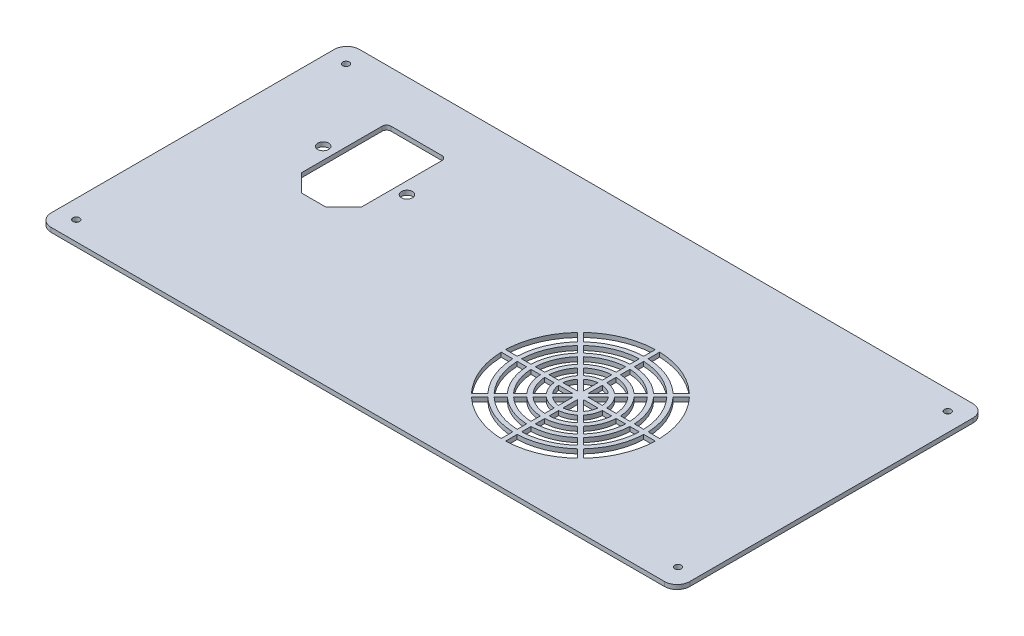
from build123d import *

# Parameters (mm, degrees)
SKETCH1_W          = 290
SKETCH1_H          = 140
BASE_FLANGE1_DEPTH = 2
SKETCH6_R          = 1.5
CUT_EXTRUDE1_DEPTH = 2
FILLET1_R          = 5.7366
SKETCH7_R          = 2.5
CUT_EXTRUDE2_DEPTH = 2
VENT1_START        = -2
VENT1_DEPTH        = 2


# Read off the part's stored shape, not the designer's step: Vent1
# Sheet-metal steps are written as plain solids
with BuildPart() as part:
    # Sketch1 → Base-Flange1 (new body)
    with BuildSketch(Plane(origin=(0, 0, 0), x_dir=(1, 0, 0), z_dir=(0, 1, 0))):
        with Locations((145, -70)):
            Rectangle(SKETCH1_W, SKETCH1_H)
    extrude(amount=-BASE_FLANGE1_DEPTH)

    # Sketch6 → Cut-Extrude1 (cut)
    with BuildSketch(Plane(origin=(0, 0, 0), x_dir=(1, 0, 0), z_dir=(0, 1, 0))):
        with Locations(Location((8.3683, -8.7366, 0), (0, 0, 270))):
            Circle(SKETCH6_R)
        with Locations(Location((281.6317, -8.7366, 0), (0, 0, 270))):
            Circle(SKETCH6_R)
        with Locations(Location((281.6317, -131.2634, 0), (0, 0, 270))):
            Circle(SKETCH6_R)
        with Locations(Location((8.3683, -131.2634, 0), (0, 0, 270))):
            Circle(SKETCH6_R)
    extrude(amount=-CUT_EXTRUDE1_DEPTH, mode=Mode.SUBTRACT)

    # Fillet1
    fillet1_edges = [part.edges().sort_by_distance(p)[0] for p in [
        (0, -1, 0),
        (290, -1, 0),
        (290, -1, 140),
        (0, -1, 140),
    ]]
    fillet(fillet1_edges, radius=FILLET1_R)

    # Sketch7 → Cut-Extrude2 (cut)
    with BuildSketch(Plane.XZ.offset(2)):
        with Locations(Location((73.638744656, 46.342445257, 0), (0, 0, 270))):
            Circle(SKETCH7_R)
        with Locations(Location((35.598744656, 46.342445257, 0), (0, 0, 270))):
            Circle(SKETCH7_R)
        with BuildLine():
            Line((68.173744656, 61.645917903), (68.173744656, 25.015666021))
            ThreePointArc((68.173744656, 25.015666021), (67.587958218, 23.601452459), (66.173744656, 23.015666021))
            Line((66.173744656, 23.015666021), (43.063744656, 23.015666021))
            ThreePointArc((43.063744656, 23.015666021), (41.649531093, 23.601452459), (41.063744656, 25.015666021))
            Line((41.063744656, 25.015666021), (41.063744656, 61.645917903))
            Line((41.063744656, 61.645917903), (49.068744656, 69.635666021))
            Line((49.068744656, 69.635666021), (60.168744656, 69.635666021))
            Line((60.168744656, 69.635666021), (68.173744656, 61.645917903))
        make_face()
    extrude(amount=-CUT_EXTRUDE2_DEPTH, mode=Mode.SUBTRACT)

    # Vent1 outline → Vent1 (cut)
    with BuildSketch(Plane(origin=(0, 0, 0), x_dir=(1, 0, 0), z_dir=(0, 1, 0)).offset(VENT1_START)):
        with BuildLine():
            Line((170.222148937, -65.55259009), (166.508051013, -61.838493933))
            add(Edge.make_bspline(
                [(166.508051013, -61.838493933), (165.164181932, -63.261607055), (162.506821573, -66.595130904), (159.40953845, -72.389740062), (157.502240973, -78.677257217), (157.024121171, -82.913451877), (156.968087147, -84.870003572)],
                knots=[0.37954792, 0.37954792, 0.37954792, 0.37954792, 0.40625, 0.4375, 0.46875, 0.495452077, 0.495452077, 0.495452077, 0.495452077], degree=3))
            Line((156.968087147, -84.870003572), (162.220613562, -84.870004684))
            add(Edge.make_bspline(
                [(170.222148937, -65.55259009), (169.120140685, -66.731444679), (166.900168028, -69.530691555), (164.291172405, -74.411779053), (162.684560899, -79.7080674), (162.274952157, -83.257191332), (162.220613562, -84.870004684)],
                knots=[0.380350766, 0.380350766, 0.380350766, 0.380350766, 0.40625, 0.4375, 0.46875, 0.49464923, 0.49464923, 0.49464923, 0.49464923], degree=3))
        make_face()
        with BuildLine():
            Line((221.686916079, -84.870004937), (226.939442491, -84.87000379))
            add(Edge.make_bspline(
                [(226.939442491, -84.87000379), (226.883408477, -82.913452022), (226.40528868, -78.677257286), (224.497991182, -72.389740062), (221.400708145, -66.595131066), (218.743347928, -63.261607341), (217.399478995, -61.838494332)],
                knots=[0.004547922, 0.004547922, 0.004547922, 0.004547922, 0.03125, 0.0625, 0.09375, 0.120452077, 0.120452077, 0.120452077, 0.120452077], degree=3))
            Line((217.399478995, -61.838494332), (213.685381163, -65.552590591))
            add(Edge.make_bspline(
                [(221.686916079, -84.870004937), (221.632577494, -83.2571915), (221.222968757, -79.708067481), (219.616357227, -74.411779053), (217.007361712, -69.530691758), (214.787389232, -66.731445039), (213.685381163, -65.552590591)],
                knots=[0.005350769, 0.005350769, 0.005350769, 0.005350769, 0.03125, 0.0625, 0.09375, 0.11964923, 0.11964923, 0.11964923, 0.11964923], degree=3))
        make_face()
        with BuildLine():
            Line((171.636358789, -107.601619508), (167.922258745, -111.3157138))
            add(Edge.make_bspline(
                [(167.922258745, -111.3157138), (169.345371868, -112.659582882), (172.678895719, -115.316943242), (178.473504878, -118.414226366), (184.76102204, -120.321523845), (188.997216709, -120.799643646), (190.953768413, -120.855677669)],
                knots=[0.62954792, 0.62954792, 0.62954792, 0.62954792, 0.65625, 0.6875, 0.71875, 0.745452078, 0.745452078, 0.745452078, 0.745452078], degree=3))
            Line((190.953768413, -120.855677669), (190.9537695, -115.603151254))
            add(Edge.make_bspline(
                [(171.636358789, -107.601619508), (172.815212281, -108.70362634), (175.614457941, -110.923597627), (180.495543869, -113.532592411), (185.791832215, -115.139203916), (189.340956148, -115.548812659), (190.9537695, -115.603151254)],
                knots=[0.630350795, 0.630350795, 0.630350795, 0.630350795, 0.65625, 0.6875, 0.71875, 0.74464923, 0.74464923, 0.74464923, 0.74464923], degree=3))
        make_face()
        with BuildLine():
            Line((190.953770185, -56.136848723), (190.953768936, -50.884322316))
            add(Edge.make_bspline(
                [(190.953768936, -50.884322316), (188.997217057, -50.940356314), (184.761022208, -51.418476104), (178.473504878, -53.325773634), (172.678895882, -56.423056671), (169.345372157, -59.080416888), (167.922259147, -60.424285821)],
                knots=[0.25454792, 0.25454792, 0.25454792, 0.25454792, 0.28125, 0.3125, 0.34375, 0.370452077, 0.370452077, 0.370452077, 0.370452077], degree=3))
            Line((167.922259147, -60.424285821), (171.636355407, -64.138383653))
            add(Edge.make_bspline(
                [(190.953770185, -56.136848723), (189.340956603, -56.191187289), (185.791832435, -56.600796017), (180.495543869, -58.207407589), (175.614456574, -60.816403104), (172.815209855, -63.036375584), (171.636355407, -64.138383653)],
                knots=[0.255350766, 0.255350766, 0.255350766, 0.255350766, 0.28125, 0.3125, 0.34375, 0.36964923, 0.36964923, 0.36964923, 0.36964923], degree=3))
        make_face()
        with BuildLine():
            Line((162.220613538, -86.869994631), (156.968087132, -86.86999588))
            add(Edge.make_bspline(
                [(156.968087132, -86.86999588), (157.02412113, -88.826547759), (157.50224092, -93.062742608), (159.40953845, -99.350259938), (162.506821487, -105.144868934), (165.164181703, -108.478392659), (166.508050637, -109.901505668)],
                knots=[0.50454792, 0.50454792, 0.50454792, 0.50454792, 0.53125, 0.5625, 0.59375, 0.620452077, 0.620452077, 0.620452077, 0.620452077], degree=3))
            Line((166.508050637, -109.901505668), (170.22214529, -106.187406009))
            add(Edge.make_bspline(
                [(162.220613538, -86.869994631), (162.274952105, -88.482808213), (162.684560833, -92.031932381), (164.291172405, -97.328220947), (166.900167185, -102.209306867), (169.120138466, -105.008552522), (170.22214529, -106.187406009)],
                knots=[0.505350766, 0.505350766, 0.505350766, 0.505350766, 0.53125, 0.5625, 0.59375, 0.619649205, 0.619649205, 0.619649205, 0.619649205], degree=3))
        make_face()
        with BuildLine():
            Line((192.953759447, -115.603151277), (192.953760721, -120.855677683))
            add(Edge.make_bspline(
                [(192.953760721, -120.855677683), (194.910312592, -120.799643684), (199.146507432, -120.321523894), (205.434024754, -118.414226366), (211.228633757, -115.316943325), (214.562157487, -112.659583102), (215.985270502, -111.315714162)],
                knots=[0.75454792, 0.75454792, 0.75454792, 0.75454792, 0.78125, 0.8125, 0.84375, 0.870452078, 0.870452078, 0.870452078, 0.870452078], degree=3))
            Line((215.985270502, -111.315714162), (212.271174225, -107.601616347))
            add(Edge.make_bspline(
                [(192.953759447, -115.603151277), (194.566573029, -115.548812711), (198.115697197, -115.139203983), (203.411985763, -113.532592411), (208.293073058, -110.923596896), (211.092319777, -108.703624416), (212.271174225, -107.601616347)],
                knots=[0.755350766, 0.755350766, 0.755350766, 0.755350766, 0.78125, 0.8125, 0.84375, 0.86964923, 0.86964923, 0.86964923, 0.86964923], degree=3))
        make_face()
        with BuildLine():
            Line((212.271174726, -64.138384121), (215.985270883, -60.424286197))
            add(Edge.make_bspline(
                [(215.985270883, -60.424286197), (214.562157761, -59.080417116), (211.228633912, -56.423056758), (205.434024754, -53.325773634), (199.146507599, -51.418476157), (194.910312939, -50.940356355), (192.953761244, -50.884322331)],
                knots=[0.12954792, 0.12954792, 0.12954792, 0.12954792, 0.15625, 0.1875, 0.21875, 0.245452077, 0.245452077, 0.245452077, 0.245452077], degree=3))
            Line((192.953761244, -50.884322331), (192.953760132, -56.136848746))
            add(Edge.make_bspline(
                [(212.271174726, -64.138384121), (211.092320136, -63.036375869), (208.293073261, -60.816403212), (203.411985763, -58.207407589), (198.115697416, -56.600796084), (194.566573484, -56.191187341), (192.953760132, -56.136848746)],
                knots=[0.130350766, 0.130350766, 0.130350766, 0.130350766, 0.15625, 0.1875, 0.21875, 0.24464923, 0.24464923, 0.24464923, 0.24464923], degree=3))
        make_face()
        with BuildLine():
            Line((213.685380695, -106.18740991), (217.399478636, -109.901506049))
            add(Edge.make_bspline(
                [(217.399478636, -109.901506049), (218.74334771, -108.478392932), (221.400708062, -105.144869088), (224.497991182, -99.350259938), (226.40528869, -93.062742679), (226.883408485, -88.826547907), (226.939442494, -86.869996103)],
                knots=[0.87954792, 0.87954792, 0.87954792, 0.87954792, 0.90625, 0.9375, 0.96875, 0.995452079, 0.995452079, 0.995452079, 0.995452079], degree=3))
            Line((226.939442494, -86.869996103), (221.686916085, -86.869994884))
            add(Edge.make_bspline(
                [(213.685380695, -106.18740991), (214.787388947, -105.008555321), (217.007361604, -102.209308445), (219.616357227, -97.328220947), (221.222968774, -92.031932462), (221.632577508, -88.482808381), (221.686916085, -86.869994884)],
                knots=[0.880350766, 0.880350766, 0.880350766, 0.880350766, 0.90625, 0.9375, 0.96875, 0.994649232, 0.994649232, 0.994649232, 0.994649232], degree=3))
        make_face()
        with BuildLine():
            Line((209.262799319, -101.764821029), (212.270312417, -104.772334067))
            add(Edge.make_bspline(
                [(212.270312417, -104.772334067), (213.280293031, -103.686658395), (215.333708027, -101.09099548), (217.756687149, -96.557920379), (219.248750323, -91.639247274), (219.632177504, -88.351852764), (219.685701993, -86.869999999)],
                knots=[0.880736599, 0.880736599, 0.880736599, 0.880736599, 0.90625, 0.9375, 0.96875, 0.994263401, 0.994263401, 0.994263401, 0.994263401], degree=3))
            Line((219.685701993, -86.869999999), (215.432436224, -86.869999957))
            add(Edge.make_bspline(
                [(209.262799319, -101.764821029), (210.077529456, -100.877492622), (211.777196414, -98.714576246), (213.804888233, -94.921031672), (215.053534688, -90.80479595), (215.381101494, -88.073537089), (215.432436224, -86.869999957)],
                knots=[0.881774646, 0.881774646, 0.881774646, 0.881774646, 0.90625, 0.9375, 0.96875, 0.993225354, 0.993225354, 0.993225354, 0.993225354], degree=3))
        make_face()
        with BuildLine():
            Line((215.432436223, -84.870000039), (219.685701993, -84.87))
            add(Edge.make_bspline(
                [(219.685701993, -84.87), (219.632177504, -83.388147236), (219.248750323, -80.100752726), (217.756687149, -75.182079621), (215.33370803, -70.649004526), (213.280293039, -68.053341615), (212.27031243, -66.967665947)],
                knots=[0.005736599, 0.005736599, 0.005736599, 0.005736599, 0.03125, 0.0625, 0.09375, 0.119263401, 0.119263401, 0.119263401, 0.119263401], degree=3))
            Line((212.27031243, -66.967665947), (209.262799322, -69.975178974))
            add(Edge.make_bspline(
                [(215.432436223, -84.870000039), (215.381101493, -83.666462908), (215.053534688, -80.935204048), (213.804888233, -76.818968328), (211.777196414, -73.025423755), (210.077529458, -70.862507381), (209.262799322, -69.975178974)],
                knots=[0.006774646, 0.006774646, 0.006774646, 0.006774646, 0.03125, 0.0625, 0.09375, 0.118225354, 0.118225354, 0.118225354, 0.118225354], degree=3))
        make_face()
        with BuildLine():
            Line((168.475093408, -86.869999957), (164.221827639, -86.87))
            add(Edge.make_bspline(
                [(164.221827639, -86.87), (164.275352128, -88.351852764), (164.658779309, -91.639247274), (166.150842483, -96.557920379), (168.573821601, -101.090995474), (170.627236593, -103.686658385), (171.637217202, -104.772334053)],
                knots=[0.505736599, 0.505736599, 0.505736599, 0.505736599, 0.53125, 0.5625, 0.59375, 0.619263401, 0.619263401, 0.619263401, 0.619263401], degree=3))
            Line((171.637217202, -104.772334053), (174.644730296, -101.764821011))
            add(Edge.make_bspline(
                [(168.475093408, -86.869999957), (168.526428138, -88.073537089), (168.853994943, -90.80479595), (170.102641399, -94.921031672), (172.130333214, -98.714576239), (173.830000166, -100.877492609), (174.644730296, -101.764821011)],
                knots=[0.506774646, 0.506774646, 0.506774646, 0.506774646, 0.53125, 0.5625, 0.59375, 0.618225354, 0.618225354, 0.618225354, 0.618225354], degree=3))
        make_face()
        with BuildLine():
            Line((174.6447303, -69.975178985), (171.637217201, -66.967665947))
            add(Edge.make_bspline(
                [(171.637217201, -66.967665947), (170.627236593, -68.053341615), (168.573821601, -70.649004526), (166.150842483, -75.182079621), (164.658779309, -80.100752726), (164.275352128, -83.388147236), (164.221827639, -84.870000001)],
                knots=[0.380736599, 0.380736599, 0.380736599, 0.380736599, 0.40625, 0.4375, 0.46875, 0.494263401, 0.494263401, 0.494263401, 0.494263401], degree=3))
            Line((164.221827639, -84.870000001), (168.475093408, -84.870000038))
            add(Edge.make_bspline(
                [(174.6447303, -69.975178985), (173.830000168, -70.862507388), (172.130333215, -73.02542376), (170.102641399, -76.818968328), (168.853994944, -80.935204048), (168.526428138, -83.666462908), (168.475093408, -84.870000038)],
                knots=[0.381774646, 0.381774646, 0.381774646, 0.381774646, 0.40625, 0.4375, 0.46875, 0.493225354, 0.493225354, 0.493225354, 0.493225354], degree=3))
        make_face()
        with BuildLine():
            Line((192.953764753, -109.348671409), (192.953764796, -113.601937178))
            add(Edge.make_bspline(
                [(192.953764796, -113.601937178), (194.435617567, -113.548412689), (197.723012084, -113.164985509), (202.641685195, -111.672922333), (207.17476029, -109.249943214), (209.770423201, -107.196528223), (210.856098869, -106.186547614)],
                knots=[0.755736599, 0.755736599, 0.755736599, 0.755736599, 0.78125, 0.8125, 0.84375, 0.869263401, 0.869263401, 0.869263401, 0.869263401], degree=3))
            Line((210.856098869, -106.186547614), (207.848585827, -103.17903452))
            add(Edge.make_bspline(
                [(192.953764753, -109.348671409), (194.157301892, -109.297336679), (196.88856076, -108.969769874), (201.004796488, -107.721123417), (204.798341055, -105.693431602), (206.961257425, -103.99376465), (207.848585827, -103.17903452)],
                knots=[0.756774646, 0.756774646, 0.756774646, 0.756774646, 0.78125, 0.8125, 0.84375, 0.868225354, 0.868225354, 0.868225354, 0.868225354], degree=3))
        make_face()
        with BuildLine():
            Line((176.058943787, -103.179034503), (173.051430749, -106.186547601))
            add(Edge.make_bspline(
                [(173.051430749, -106.186547601), (174.137106421, -107.196528215), (176.732769336, -109.249943211), (181.265844437, -111.672922333), (186.184517542, -113.164985507), (189.471912052, -113.548412688), (190.953764816, -113.601937177)],
                knots=[0.630736599, 0.630736599, 0.630736599, 0.630736599, 0.65625, 0.6875, 0.71875, 0.744263401, 0.744263401, 0.744263401, 0.744263401], degree=3))
            Line((190.953764816, -113.601937177), (190.953764854, -109.348671407))
            add(Edge.make_bspline(
                [(176.058943787, -103.179034503), (176.946272194, -103.99376464), (179.10918857, -105.693431598), (182.902733143, -107.721123417), (187.018968864, -108.969769872), (189.750227724, -109.297336678), (190.953764854, -109.348671407)],
                knots=[0.631774646, 0.631774646, 0.631774646, 0.631774646, 0.65625, 0.6875, 0.71875, 0.743225354, 0.743225354, 0.743225354, 0.743225354], degree=3))
        make_face()
        with BuildLine():
            Line((207.848585831, -68.560965484), (210.856098868, -65.553452385))
            add(Edge.make_bspline(
                [(210.856098868, -65.553452385), (209.770423201, -64.543471777), (207.17476029, -62.490056785), (202.641685195, -60.067077667), (197.72301209, -58.575014493), (194.43561758, -58.191587312), (192.953764815, -58.138062823)],
                knots=[0.130736599, 0.130736599, 0.130736599, 0.130736599, 0.15625, 0.1875, 0.21875, 0.244263401, 0.244263401, 0.244263401, 0.244263401], degree=3))
            Line((192.953764815, -58.138062823), (192.953764758, -62.391328592))
            add(Edge.make_bspline(
                [(207.848585831, -68.560965484), (206.961257428, -67.746235352), (204.798341056, -66.046568399), (201.004796488, -64.018876583), (196.888560762, -62.770230126), (194.157301895, -62.442663321), (192.953764758, -62.391328592)],
                knots=[0.131774646, 0.131774646, 0.131774646, 0.131774646, 0.15625, 0.1875, 0.21875, 0.243225354, 0.243225354, 0.243225354, 0.243225354], degree=3))
        make_face()
        with BuildLine():
            Line((190.953764859, -62.391328592), (190.953764816, -58.138062823))
            add(Edge.make_bspline(
                [(190.953764816, -58.138062823), (189.471912052, -58.191587312), (186.184517541, -58.575014493), (181.265844437, -60.067077667), (176.732769341, -62.490056786), (174.137106431, -64.543471777), (173.051430763, -65.553452386)],
                knots=[0.255736599, 0.255736599, 0.255736599, 0.255736599, 0.28125, 0.3125, 0.34375, 0.369263401, 0.369263401, 0.369263401, 0.369263401], degree=3))
            Line((173.051430763, -65.553452386), (176.05894379, -68.560965494))
            add(Edge.make_bspline(
                [(190.953764859, -62.391328592), (189.750227727, -62.442663322), (187.018968866, -62.770230128), (182.902733143, -64.018876583), (179.109188571, -66.046568401), (176.946272196, -67.746235358), (176.05894379, -68.560965494)],
                knots=[0.256774646, 0.256774646, 0.256774646, 0.256774646, 0.28125, 0.3125, 0.34375, 0.368225354, 0.368225354, 0.368225354, 0.368225354], degree=3))
        make_face()
        with BuildLine():
            Line((200.406803083, -92.90883572), (203.421003499, -95.923034243))
            add(Edge.make_bspline(
                [(203.421003499, -95.923034243), (203.859055139, -95.423312532), (204.873418127, -94.10145535), (206.133749161, -91.74354183), (206.90985718, -89.185056568), (207.12728841, -87.533099442), (207.170895735, -86.869993544)],
                knots=[0.88544388, 0.88544388, 0.88544388, 0.88544388, 0.90625, 0.9375, 0.96875, 0.98955612, 0.98955612, 0.98955612, 0.98955612], degree=3))
            Line((207.170895735, -86.869993544), (202.90817401, -86.869991724))
            add(Edge.make_bspline(
                [(200.406803083, -92.90883572), (200.653899904, -92.612086659), (201.316997501, -91.72486589), (202.181950245, -90.106653123), (202.714585563, -88.350789795), (202.873064576, -87.254548999), (202.90817401, -86.869991724)],
                knots=[0.889488586, 0.889488586, 0.889488586, 0.889488586, 0.90625, 0.9375, 0.96875, 0.985511421, 0.985511421, 0.985511421, 0.985511421], degree=3))
        make_face()
        with BuildLine():
            add(Edge.make_bspline(
                [(204.837913604, -97.339943273), (205.366822748, -96.745756458), (206.547052368, -95.219804489), (207.993419239, -92.513842398), (208.884087554, -89.577702454), (209.128550171, -87.664143127), (209.174708457, -86.869994383)],
                knots=[0.884231557, 0.884231557, 0.884231557, 0.884231557, 0.90625, 0.9375, 0.96875, 0.990768442, 0.990768442, 0.990768442, 0.990768442], degree=3))
            Line((204.837913604, -97.339943273), (207.847183017, -100.349204728))
            add(Edge.make_bspline(
                [(207.847183017, -100.349204728), (208.570230124, -99.555439517), (210.103546827, -97.596255817), (211.945218155, -94.150731105), (213.079313757, -90.412118937), (213.380447199, -87.942548225), (213.430452451, -86.869999956)],
                knots=[0.88240528, 0.88240528, 0.88240528, 0.88240528, 0.90625, 0.9375, 0.96875, 0.99259472, 0.99259472, 0.99259472, 0.99259472], degree=3))
            Line((213.430452451, -86.869999956), (209.174708457, -86.869994383))
        make_face()
        with BuildLine():
            Line((202.908173905, -84.87000713), (207.1708957, -84.870005921))
            add(Edge.make_bspline(
                [(207.1708957, -84.870005921), (207.127288364, -84.206900203), (206.909857128, -82.55494326), (206.133749161, -79.99645817), (204.87341821, -77.638544806), (203.859055353, -76.316687747), (203.421003846, -75.816966153)],
                knots=[0.010443886, 0.010443886, 0.010443886, 0.010443886, 0.03125, 0.0625, 0.09375, 0.114556114, 0.114556114, 0.114556114, 0.114556114], degree=3))
            Line((203.421003846, -75.816966153), (200.406803194, -78.831164414))
            add(Edge.make_bspline(
                [(202.908173905, -84.87000713), (202.873064466, -84.485450241), (202.714585451, -83.389209836), (202.181950245, -81.633346877), (201.316997529, -80.015134161), (200.653899973, -79.127913434), (200.406803194, -78.831164414)],
                knots=[0.014488596, 0.014488596, 0.014488596, 0.014488596, 0.03125, 0.0625, 0.09375, 0.110511411, 0.110511411, 0.110511411, 0.110511411], degree=3))
        make_face()
        with BuildLine():
            add(Edge.make_bspline(
                [(209.174708434, -84.870005225), (209.128550138, -84.075856613), (208.884087515, -82.16229742), (207.993419239, -79.226157602), (206.547052453, -76.52019567), (205.366822968, -74.994243828), (204.837913962, -74.40005713)],
                knots=[0.009231562, 0.009231562, 0.009231562, 0.009231562, 0.03125, 0.0625, 0.09375, 0.115768438, 0.115768438, 0.115768438, 0.115768438], degree=3))
            Line((209.174708434, -84.870005225), (213.43045245, -84.870000039))
            add(Edge.make_bspline(
                [(213.43045245, -84.870000039), (213.380447198, -83.797451772), (213.079313757, -81.327881062), (211.945218155, -77.589268895), (210.103546828, -74.143744184), (208.570230125, -72.184560485), (207.84718302, -71.390795275)],
                knots=[0.00740528, 0.00740528, 0.00740528, 0.00740528, 0.03125, 0.0625, 0.09375, 0.11759472, 0.11759472, 0.11759472, 0.11759472], degree=3))
            Line((207.84718302, -71.390795275), (204.837913962, -74.40005713))
        make_face()
        with BuildLine():
            Line((180.999355667, -86.869992211), (176.736633897, -86.869993549))
            add(Edge.make_bspline(
                [(176.736633897, -86.869993549), (176.780241222, -87.533099445), (176.997672452, -89.18505657), (177.773780471, -91.74354183), (179.034111423, -94.101455197), (180.048474282, -95.423312258), (180.486525792, -95.923033855)],
                knots=[0.51044388, 0.51044388, 0.51044388, 0.51044388, 0.53125, 0.5625, 0.59375, 0.614556114, 0.614556114, 0.614556114, 0.614556114], degree=3))
            Line((180.486525792, -95.923033855), (183.500726444, -92.908835593))
            add(Edge.make_bspline(
                [(180.999355667, -86.869992211), (181.034465102, -87.254549322), (181.192944117, -88.350789952), (181.725579387, -90.106653123), (182.590532105, -91.724865841), (183.253629662, -92.612086571), (183.500726444, -92.908835593)],
                knots=[0.514488586, 0.514488586, 0.514488586, 0.514488586, 0.53125, 0.5625, 0.59375, 0.610511411, 0.610511411, 0.610511411, 0.610511411], degree=3))
        make_face()
        with BuildLine():
            add(Edge.make_bspline(
                [(174.73282117, -86.86999431), (174.778979454, -87.664143078), (175.023442071, -89.577702431), (175.914110393, -92.513842398), (177.360477179, -95.21980433), (178.540706663, -96.745756172), (179.069615669, -97.33994287)],
                knots=[0.509231557, 0.509231557, 0.509231557, 0.509231557, 0.53125, 0.5625, 0.59375, 0.615768438, 0.615768438, 0.615768438, 0.615768438], degree=3))
            Line((174.73282117, -86.86999431), (170.477077181, -86.869999956))
            add(Edge.make_bspline(
                [(170.477077181, -86.869999956), (170.527082433, -87.942548225), (170.828215874, -90.412118937), (171.962311477, -94.150731105), (173.803982801, -97.59625581), (175.337299498, -99.555439505), (176.060346599, -100.349204711)],
                knots=[0.50740528, 0.50740528, 0.50740528, 0.50740528, 0.53125, 0.5625, 0.59375, 0.61759472, 0.61759472, 0.61759472, 0.61759472], degree=3))
            Line((176.060346599, -100.349204711), (179.069615669, -97.33994287))
        make_face()
        with BuildLine():
            Line((183.500726549, -78.83116428), (180.486526133, -75.816965757))
            add(Edge.make_bspline(
                [(180.486526133, -75.816965757), (180.048474492, -76.316687468), (179.034111505, -77.63854465), (177.773780471, -79.99645817), (176.997672503, -82.554943261), (176.780241268, -84.206900206), (176.736633931, -84.870005925)],
                knots=[0.38544388, 0.38544388, 0.38544388, 0.38544388, 0.40625, 0.4375, 0.46875, 0.489556114, 0.489556114, 0.489556114, 0.489556114], degree=3))
            Line((176.736633931, -84.870005925), (180.999355682, -84.870007616))
            add(Edge.make_bspline(
                [(183.500726549, -78.83116428), (183.253629728, -79.127913341), (182.590532131, -80.01513411), (181.725579387, -81.633346877), (181.192944134, -83.389209992), (181.034465119, -84.485450563), (180.999355682, -84.870007616)],
                knots=[0.389488586, 0.389488586, 0.389488586, 0.389488586, 0.40625, 0.4375, 0.46875, 0.485511411, 0.485511411, 0.485511411, 0.485511411], degree=3))
        make_face()
        with BuildLine():
            add(Edge.make_bspline(
                [(179.069616028, -74.400056727), (178.540706884, -74.994243542), (177.360477264, -76.520195511), (175.914110393, -79.226157602), (175.023442123, -82.162297396), (174.7789795, -84.075856564), (174.732821202, -84.870005152)],
                knots=[0.384231557, 0.384231557, 0.384231557, 0.384231557, 0.40625, 0.4375, 0.46875, 0.490768438, 0.490768438, 0.490768438, 0.490768438], degree=3))
            Line((179.069616028, -74.400056727), (176.060346602, -71.390795286))
            add(Edge.make_bspline(
                [(176.060346602, -71.390795286), (175.3372995, -72.184560493), (173.803982802, -74.143744189), (171.962311477, -77.589268895), (170.828215875, -81.327881062), (170.527082433, -83.797451772), (170.477077181, -84.87000004)],
                knots=[0.38240528, 0.38240528, 0.38240528, 0.38240528, 0.40625, 0.4375, 0.46875, 0.49259472, 0.49259472, 0.49259472, 0.49259472], degree=3))
            Line((170.477077181, -84.87000004), (174.732821202, -84.870005152))
        make_face()
        with BuildLine():
            Line((192.953757027, -96.824409149), (192.953758365, -101.087130919))
            add(Edge.make_bspline(
                [(192.953758365, -101.087130919), (193.616864261, -101.043523594), (195.268821386, -100.826092364), (197.827306646, -100.049984345), (200.18522001, -98.789653394), (201.507077069, -97.775290538), (202.006798663, -97.33723903)],
                knots=[0.76044388, 0.76044388, 0.76044388, 0.76044388, 0.78125, 0.8125, 0.84375, 0.864556114, 0.864556114, 0.864556114, 0.864556114], degree=3))
            Line((202.006798663, -97.33723903), (198.992600402, -94.323038378))
            add(Edge.make_bspline(
                [(192.953757027, -96.824409149), (193.338314138, -96.789299714), (194.434554768, -96.630820699), (196.190417939, -96.098185429), (197.808630654, -95.233232713), (198.695851381, -94.570135157), (198.992600402, -94.323038378)],
                knots=[0.764488586, 0.764488586, 0.764488586, 0.764488586, 0.78125, 0.8125, 0.84375, 0.860511411, 0.860511411, 0.860511411, 0.860511411], degree=3))
        make_face()
        with BuildLine():
            add(Edge.make_bspline(
                [(192.953759126, -103.090943646), (193.747907894, -103.044785362), (195.661467247, -102.800322745), (198.597607214, -101.909654423), (201.303569146, -100.463287637), (202.829520988, -99.283058152), (203.423707686, -98.754149147)],
                knots=[0.759231557, 0.759231557, 0.759231557, 0.759231557, 0.78125, 0.8125, 0.84375, 0.865768438, 0.865768438, 0.865768438, 0.865768438], degree=3))
            Line((192.953759126, -103.090943646), (192.953764753, -107.346687636))
            add(Edge.make_bspline(
                [(192.953764753, -107.346687636), (194.026313028, -107.296682385), (196.495883747, -106.995548943), (200.23449592, -105.861453339), (203.680020626, -104.019782015), (205.639204321, -102.486465317), (206.432969527, -101.763418217)],
                knots=[0.75740528, 0.75740528, 0.75740528, 0.75740528, 0.78125, 0.8125, 0.84375, 0.86759472, 0.86759472, 0.86759472, 0.86759472], degree=3))
            Line((206.432969527, -101.763418217), (203.423707686, -98.754149147))
        make_face()
        with BuildLine():
            Line((184.914929089, -94.323038261), (181.900730565, -97.337238677))
            add(Edge.make_bspline(
                [(181.900730565, -97.337238677), (182.400452279, -97.77529032), (183.722309463, -98.78965331), (186.080222986, -100.049984345), (188.638708077, -100.826092313), (190.290665022, -101.043523548), (190.953770741, -101.087130885)],
                knots=[0.63544388, 0.63544388, 0.63544388, 0.63544388, 0.65625, 0.6875, 0.71875, 0.739556114, 0.739556114, 0.739556114, 0.739556114], degree=3))
            Line((190.953770741, -101.087130885), (190.953772431, -96.824409133))
            add(Edge.make_bspline(
                [(184.914929089, -94.323038261), (185.211678152, -94.570135084), (186.098898923, -95.233232684), (187.717111693, -96.098185429), (189.472974808, -96.630820682), (190.569215379, -96.789299697), (190.953772431, -96.824409133)],
                knots=[0.639488586, 0.639488586, 0.639488586, 0.639488586, 0.65625, 0.6875, 0.71875, 0.735511411, 0.735511411, 0.735511411, 0.735511411], degree=3))
        make_face()
        with BuildLine():
            add(Edge.make_bspline(
                [(180.483821536, -98.754148781), (181.078008353, -99.283057928), (182.603960324, -100.46328755), (185.309922418, -101.909654423), (188.246062212, -102.800322692), (190.15962138, -103.044785316), (190.953769967, -103.090943614)],
                knots=[0.634231557, 0.634231557, 0.634231557, 0.634231557, 0.65625, 0.6875, 0.71875, 0.740768438, 0.740768438, 0.740768438, 0.740768438], degree=3))
            Line((180.483821536, -98.754148781), (177.474560088, -101.763418201))
            add(Edge.make_bspline(
                [(177.474560088, -101.763418201), (178.268325299, -102.486465308), (180.227508999, -104.019782011), (183.673033711, -105.861453339), (187.411645878, -106.995548941), (189.881216588, -107.296682383), (190.953764856, -107.346687635)],
                knots=[0.63240528, 0.63240528, 0.63240528, 0.63240528, 0.65625, 0.6875, 0.71875, 0.74259472, 0.74259472, 0.74259472, 0.74259472], degree=3))
            Line((190.953764856, -107.346687635), (190.953769967, -103.090943614))
        make_face()
        with BuildLine():
            Line((198.992600536, -77.416961733), (202.006799059, -74.402761317))
            add(Edge.make_bspline(
                [(202.006799059, -74.402761317), (201.507077348, -73.964709677), (200.185220166, -72.950346689), (197.827306646, -71.690015655), (195.268821555, -70.913907687), (193.61686461, -70.696476452), (192.953758891, -70.652869115)],
                knots=[0.13544388, 0.13544388, 0.13544388, 0.13544388, 0.15625, 0.1875, 0.21875, 0.239556114, 0.239556114, 0.239556114, 0.239556114], degree=3))
            Line((192.953758891, -70.652869115), (192.9537572, -74.915590867))
            add(Edge.make_bspline(
                [(198.992600536, -77.416961733), (198.695851475, -77.169864912), (197.808630706, -76.506767315), (196.190417939, -75.641814571), (194.434554823, -75.109179318), (193.338314253, -74.950700303), (192.9537572, -74.915590867)],
                knots=[0.139488586, 0.139488586, 0.139488586, 0.139488586, 0.15625, 0.1875, 0.21875, 0.235511411, 0.235511411, 0.235511411, 0.235511411], degree=3))
        make_face()
        with BuildLine():
            add(Edge.make_bspline(
                [(203.423708089, -72.985851212), (202.829521273, -72.456942068), (201.303569305, -71.276712448), (198.597607214, -69.830345577), (195.661467419, -68.939677308), (193.747908252, -68.695214684), (192.953759664, -68.649056386)],
                knots=[0.134231557, 0.134231557, 0.134231557, 0.134231557, 0.15625, 0.1875, 0.21875, 0.240768438, 0.240768438, 0.240768438, 0.240768438], degree=3))
            Line((203.423708089, -72.985851212), (206.43296953, -69.976581786))
            add(Edge.make_bspline(
                [(206.43296953, -69.976581786), (205.639204323, -69.253534684), (203.680020627, -67.720217986), (200.23449592, -65.878546661), (196.495883748, -64.744451057), (194.026313031, -64.443317616), (192.953764757, -64.393312365)],
                knots=[0.13240528, 0.13240528, 0.13240528, 0.13240528, 0.15625, 0.1875, 0.21875, 0.24259472, 0.24259472, 0.24259472, 0.24259472], degree=3))
            Line((192.953764757, -64.393312365), (192.953759664, -68.649056386))
        make_face()
        with BuildLine():
            add(Edge.make_bspline(
                [(190.953770506, -68.649056354), (190.159621738, -68.695214638), (188.246062385, -68.939677255), (185.309922418, -69.830345577), (182.603960486, -71.276712363), (181.078008644, -72.456941848), (180.483821946, -72.985850853)],
                knots=[0.259231557, 0.259231557, 0.259231557, 0.259231557, 0.28125, 0.3125, 0.34375, 0.365768438, 0.365768438, 0.365768438, 0.365768438], degree=3))
            Line((190.953770506, -68.649056354), (190.95376486, -64.393312365))
            add(Edge.make_bspline(
                [(190.95376486, -64.393312365), (189.881216591, -64.443317617), (187.411645879, -64.744451059), (183.673033711, -65.878546661), (180.227509, -67.720217988), (178.268325301, -69.253534691), (177.474560091, -69.976581796)],
                knots=[0.25740528, 0.25740528, 0.25740528, 0.25740528, 0.28125, 0.3125, 0.34375, 0.36759472, 0.36759472, 0.36759472, 0.36759472], degree=3))
            Line((177.474560091, -69.976581796), (180.483821946, -72.985850853))
        make_face()
        with BuildLine():
            Line((190.953772605, -74.915590851), (190.953771267, -70.652869081))
            add(Edge.make_bspline(
                [(190.953771267, -70.652869081), (190.29066537, -70.696476406), (188.638708246, -70.913907636), (186.080222986, -71.690015655), (183.722309622, -72.950346606), (182.400452563, -73.964709462), (181.900730969, -74.40276097)],
                knots=[0.26044388, 0.26044388, 0.26044388, 0.26044388, 0.28125, 0.3125, 0.34375, 0.364556114, 0.364556114, 0.364556114, 0.364556114], degree=3))
            Line((181.900730969, -74.40276097), (184.91492923, -77.416961622))
            add(Edge.make_bspline(
                [(190.953772605, -74.915590851), (190.569215494, -74.950700286), (189.472974864, -75.109179301), (187.717111693, -75.641814571), (186.098898977, -76.506767287), (185.21167825, -77.169864843), (184.91492923, -77.416961622)],
                knots=[0.264488586, 0.264488586, 0.264488586, 0.264488586, 0.28125, 0.3125, 0.34375, 0.360511411, 0.360511411, 0.360511411, 0.360511411], degree=3))
        make_face()
        with BuildLine():
            Line((194.367978378, -86.87), (198.985398207, -91.487430136))
            add(Edge.make_bspline(
                [(198.985398207, -91.487430136), (199.144580857, -91.288181404), (199.643446892, -90.606360286), (200.322280167, -89.336352555), (200.740303736, -87.958313528), (200.869672521, -87.12344128), (200.898003529, -86.869991668)],
                knots=[0.892720395, 0.892720395, 0.892720395, 0.892720395, 0.90625, 0.9375, 0.96875, 0.982279623, 0.982279623, 0.982279623, 0.982279623], degree=3))
            Line((200.898003529, -86.869991668), (194.367978378, -86.87))
        make_face()
        with BuildLine():
            Line((194.367978378, -84.87), (200.898003341, -84.87000665))
            add(Edge.make_bspline(
                [(200.898003341, -84.87000665), (200.869672348, -84.616557604), (200.740303571, -83.781685929), (200.322280167, -82.403647445), (199.643446828, -81.133639594), (199.144580697, -80.451818377), (198.985397954, -80.252569546)],
                knots=[0.017720407, 0.017720407, 0.017720407, 0.017720407, 0.03125, 0.0625, 0.09375, 0.107279612, 0.107279612, 0.107279612, 0.107279612], degree=3))
            Line((198.985397954, -80.252569546), (194.367978378, -84.87))
        make_face()
        with BuildLine():
            Line((189.539551254, -86.87), (183.00952622, -86.869992711))
            add(Edge.make_bspline(
                [(183.00952622, -86.869992711), (183.037857218, -87.123441972), (183.167225998, -87.958313865), (183.585249465, -89.336352555), (184.264082804, -90.606360406), (184.762948935, -91.288181623), (184.922131678, -91.487430453)],
                knots=[0.517720395, 0.517720395, 0.517720395, 0.517720395, 0.53125, 0.5625, 0.59375, 0.607279612, 0.607279612, 0.607279612, 0.607279612], degree=3))
            Line((184.922131678, -91.487430453), (189.539551254, -86.87))
        make_face()
        with BuildLine():
            Line((189.539551254, -84.87), (184.922131425, -80.252569864))
            add(Edge.make_bspline(
                [(184.922131425, -80.252569864), (184.762948775, -80.451818596), (184.26408274, -81.133639714), (183.585249465, -82.403647445), (183.167225958, -83.781686265), (183.037857177, -84.616558295), (183.009526175, -84.870007692)],
                knots=[0.392720395, 0.392720395, 0.392720395, 0.392720395, 0.40625, 0.4375, 0.46875, 0.482279612, 0.482279612, 0.482279612, 0.482279612], degree=3))
            Line((183.009526175, -84.870007692), (189.539551254, -84.87))
        make_face()
        with BuildLine():
            Line((192.953764816, -88.284213562), (192.953757527, -94.814238596))
            add(Edge.make_bspline(
                [(192.953757527, -94.814238596), (193.207206788, -94.785907598), (194.042078681, -94.656538818), (195.420117371, -94.238515351), (196.690125222, -93.559682012), (197.371946439, -93.060815881), (197.571195269, -92.901633138)],
                knots=[0.767720395, 0.767720395, 0.767720395, 0.767720395, 0.78125, 0.8125, 0.84375, 0.857279612, 0.857279612, 0.857279612, 0.857279612], degree=3))
            Line((197.571195269, -92.901633138), (192.953764816, -88.284213562))
        make_face()
        with BuildLine():
            Line((190.953764816, -88.284213562), (186.336334672, -92.901633385))
            add(Edge.make_bspline(
                [(186.336334672, -92.901633385), (186.535583406, -93.060816037), (187.217404527, -93.559682075), (188.48741226, -94.238515351), (189.865451081, -94.656538857), (190.700323111, -94.785907639), (190.953772508, -94.814238641)],
                knots=[0.642720395, 0.642720395, 0.642720395, 0.642720395, 0.65625, 0.6875, 0.71875, 0.732279612, 0.732279612, 0.732279612, 0.732279612], degree=3))
            Line((190.953772508, -94.814238641), (190.953764816, -88.284213562))
        make_face()
        with BuildLine():
            Line((192.953764816, -83.455786438), (197.571194952, -78.838366609))
            add(Edge.make_bspline(
                [(197.571194952, -78.838366609), (197.37194622, -78.679183959), (196.690125102, -78.180317924), (195.420117371, -77.501484649), (194.042078551, -77.083461143), (193.20720652, -76.954092361), (192.953757124, -76.925761359)],
                knots=[0.142720395, 0.142720395, 0.142720395, 0.142720395, 0.15625, 0.1875, 0.21875, 0.232279612, 0.232279612, 0.232279612, 0.232279612], degree=3))
            Line((192.953757124, -76.925761359), (192.953764816, -83.455786438))
        make_face()
        with BuildLine():
            Line((190.953764816, -83.455786438), (190.953772104, -76.925761404))
            add(Edge.make_bspline(
                [(190.953772104, -76.925761404), (190.700322844, -76.954092402), (189.865450951, -77.083461182), (188.48741226, -77.501484649), (187.21740441, -78.180317988), (186.535583193, -78.679184119), (186.336334362, -78.838366862)],
                knots=[0.267720395, 0.267720395, 0.267720395, 0.267720395, 0.28125, 0.3125, 0.34375, 0.357279612, 0.357279612, 0.357279612, 0.357279612], degree=3))
            Line((186.336334362, -78.838366862), (190.953764816, -83.455786438))
        make_face()
    extrude(amount=VENT1_DEPTH, mode=Mode.SUBTRACT)


solid = part.part
